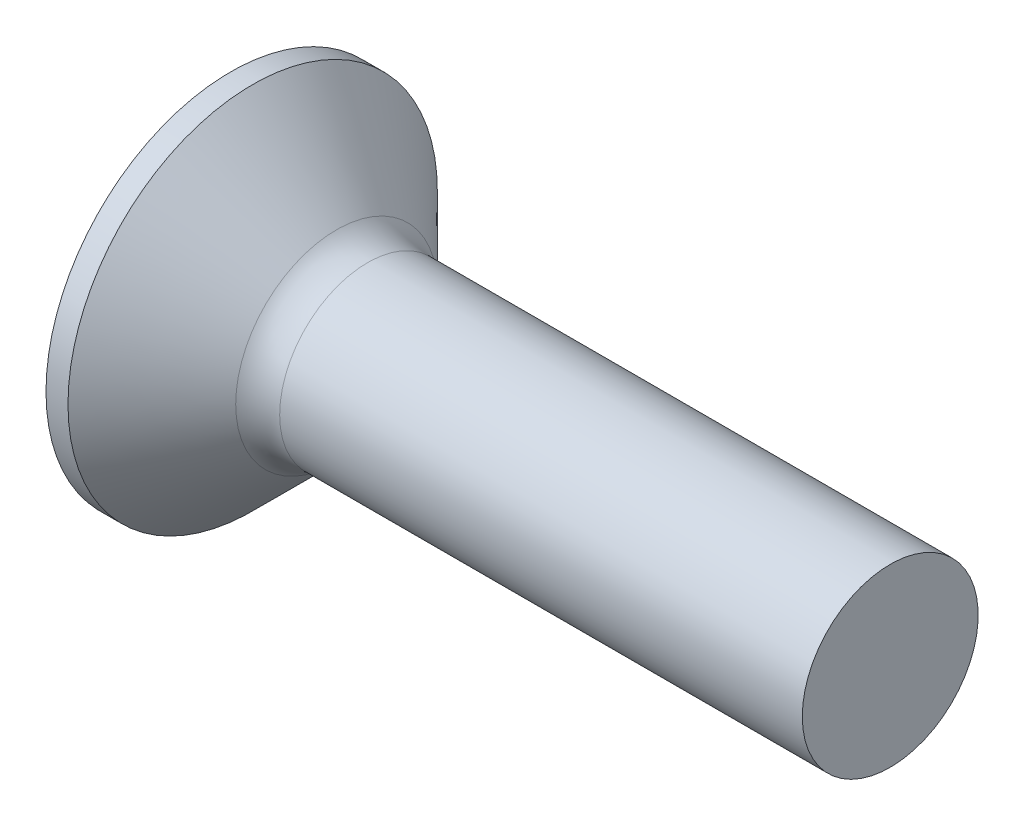
from build123d import *

# Parameters (mm, degrees)
FILLET1_R    = 1
RECPAT_COUNT = 2
RECPAT_ANGLE = 90


with BuildPart() as part:
    # BodySke → Base-Revolve (revolve)
    with BuildSketch(Plane.XY):
        Polygon((0, 0), (0, 4.2), (0.5, 4.2), (2.7, 2), (15, 2), (15, 0), align=None)
    revolve(axis=Axis((-6.35, 0, 0), (1, 0, 0)))

    # Fillet1
    fillet1_edges = [part.edges().sort_by_distance(p)[0] for p in [
        (2.7, -2, 0),
    ]]
    fillet(fillet1_edges, radius=FILLET1_R)

    # Sketch3 → Recess section 0
    with BuildSketch(Plane.ZY):
        with BuildLine():
            Line((-0.515, 2.2), (0.515, 2.2))
            Line((0.515, 2.2), (0.515, -2.2))
            Line((0.515, -2.2), (-0.515, -2.2))
            Line((-0.515, -2.2), (-0.515, 2.2))
        make_face()
    # Sketch4 → Recess section 1
    with BuildSketch(Plane.ZY.offset(-2.51)):
        with BuildLine():
            Line((-0.515, 0.948560373), (0.515, 0.948560373))
            Line((0.515, 0.948560373), (0.515, -0.948560373))
            Line((0.515, -0.948560373), (-0.515, -0.948560373))
            Line((-0.515, -0.948560373), (-0.515, 0.948560373))
        make_face()
    recess = loft(mode=Mode.SUBTRACT)

    # RecPat: Recess ×2 about axis
    recpat_axis = Axis((0, 0, 0), (1, 0, 0))
    for i in range(1, RECPAT_COUNT):
        add(recess.rotate(recpat_axis, i * RECPAT_ANGLE / (RECPAT_COUNT - 1)), mode=Mode.SUBTRACT)

    # RecCorSke → RecessCore (revolve, cut)
    with BuildSketch(Plane.XY):
        Polygon((0, 0), (0, 1.026516298), (2.51, 0.851), (2.786506661, 0), align=None)
    revolve(axis=Axis((-3.175, 0, 0), (1, 0, 0)), mode=Mode.SUBTRACT)


solid = part.part
